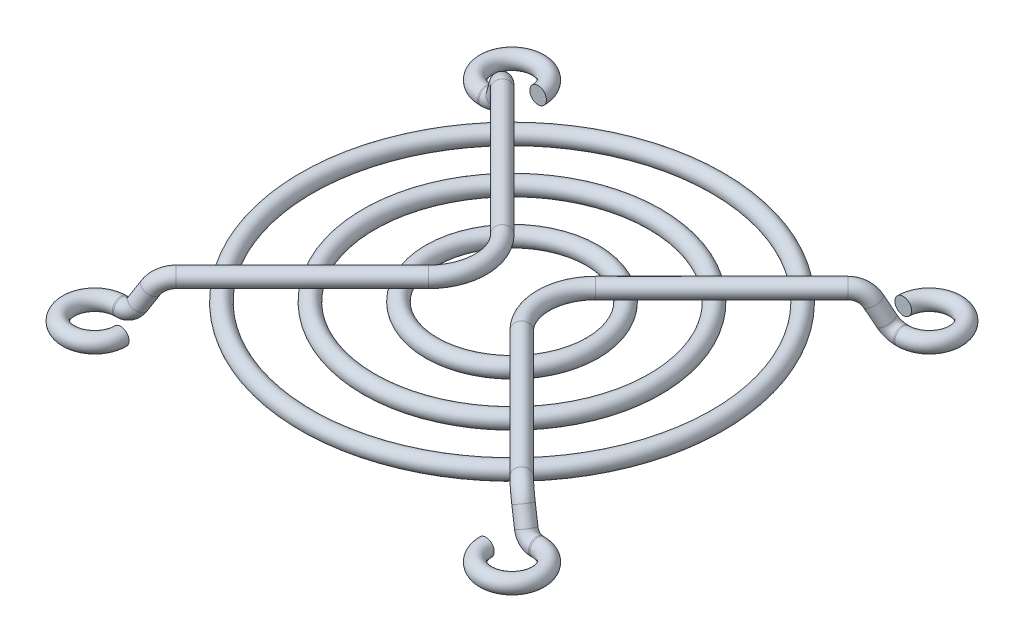
from build123d import *

# Parameters (mm, degrees)
SKETCH_2_R           = 0.8
SWEEP_2_OUTLINE_R    = 0.8
SWEEP_2_ANGLE        = 270
SWEEP_2_2_OUTLINE_R  = 0.8
SWEEP_2_2_ANGLE      = 64.201526
SWEEP_2_3_OUTLINE_R  = 0.8
SWEEP_2_3_ANGLE      = 59.495369
SWEEP_2_4_OUTLINE_R  = 0.8
SWEEP_2_4_ANGLE      = 90
SWEEP_2_5_OUTLINE_R  = 0.8
SWEEP_2_5_ANGLE      = 59.495369
SWEEP_2_6_OUTLINE_R  = 0.8
SWEEP_2_6_ANGLE      = 64.201526
SWEEP_2_7_OUTLINE_R  = 0.8
SWEEP_2_7_ANGLE      = 270
SWEEP_START          = -20.0000001
SWEEP_2_8_OUTLINE_R  = 0.8
SWEEP_2_8_DEPTH      = 0.121755873
SWEEP_START_2        = -13.704918083
SWEEP_2_9_OUTLINE_R  = 0.8
SWEEP_2_9_DEPTH      = 1.722294661
SWEEP_START_3        = -22.766167048
SWEEP_2_10_OUTLINE_R = 0.8
SWEEP_2_10_DEPTH     = 17.109312899
SWEEP_2_11_OUTLINE_R = 0.8
SWEEP_2_11_DEPTH     = 17.109312899
SWEEP_2_12_OUTLINE_R = 0.8
SWEEP_2_12_DEPTH     = 1.722294661
SWEEP_2_13_OUTLINE_R = 0.8
SWEEP_2_13_DEPTH     = 0.121755873


with BuildPart() as part:
    # По траектории1: sweep along a path in Эскиз1
    with BuildLine(Plane(origin=(0, 0, 0), x_dir=(1, 0, 0), z_dir=(0, 1, 0))) as sweep_1_path:
        CenterArc((0, 0), 19.7, 0, 360)
    # Эскиз2 → По траектории1 (sweep)
    with BuildSketch(Plane.XY):
        with Locations((19.7, 0)):
            Circle(SKETCH_2_R)
        with Locations((13.7, 0)):
            Circle(SKETCH_2_R)
        with Locations((7.7, 0)):
            Circle(SKETCH_2_R)
    sweep(path=sweep_1_path.line)


with BuildPart() as body_2:
    # По траектории2: read off the stored shape, not the designer's step
    # По траектории2 outline → По траектории2 (revolve)
    with BuildSketch(Plane(origin=(-20, 0, -20), x_dir=(1, 0, 0), z_dir=(0, 0, 1))):
        with Locations((2.5, -1.6)):
            Circle(SWEEP_2_OUTLINE_R)
    revolve(axis=Axis((-20, 0, -20), (0, 1, 0)), revolution_arc=SWEEP_2_ANGLE)

    # Sweep 2 2 outline → Sweep 2 2 (revolve)
    with BuildSketch(Plane(origin=(-19.878244327, -5.329425132, -1.762276403), x_dir=(0.9003303642061087, -0.41320279112716485, -0.13663340987187678), z_dir=(0.4352071176905264, 0.8548091340984039, 0.28265899768703884))):
        with Locations((1.4, 16.112869261)):
            Circle(SWEEP_2_2_OUTLINE_R)
    revolve(axis=Axis((-19.878244327, -5.329425132, -1.762276403), (0, 0.3139503108242731, -0.9494394147776584)), revolution_arc=SWEEP_2_2_ANGLE)

    # Sweep 2 3 outline → Sweep 2 3 (revolve)
    with BuildSketch(Plane(origin=(-16.141916519, -0.490931402, -16.054305543), x_dir=(-0.5642976565367117, 0.5036141214653419, -0.6541719739394735), z_dir=(-0.4352071176904984, -0.8548091340984196, -0.28265899768703395))):
        with Locations((2, -0.852000479)):
            Circle(SWEEP_2_3_OUTLINE_R)
    revolve(axis=Axis((-16.141916519, -0.490931402, -16.054305543), (0.701543241389085, -0.12519648925829302, -0.701543241389078)), revolution_arc=SWEEP_2_3_ANGLE)

    # Sweep 2 4 outline → Sweep 2 4 (revolve)
    with BuildSketch(Plane(origin=(-8, 0, 0), x_dir=(0.7071067811865462, 0, 0.7071067811865488), z_dir=(-0.7071067811865488, 0, 0.7071067811865462))):
        with Locations((5.000000002, 1.6)):
            Circle(SWEEP_2_4_OUTLINE_R)
    revolve(axis=Axis((-8, 0, 0), (0, 1, 0)), revolution_arc=SWEEP_2_4_ANGLE)

    # Sweep 2 5 outline → Sweep 2 5 (revolve)
    with BuildSketch(Plane(origin=(-16.141916519, -0.490931402, 16.054305543), x_dir=(0.0885272865352453, 0.9921319665636316, 0.08852728653521139), z_dir=(0.7071067811865503, -2.468164561619801e-14, -0.7071067811865446))):
        with Locations((2, -0.852000479)):
            Circle(SWEEP_2_5_OUTLINE_R)
    revolve(axis=Axis((-16.141916519, -0.490931402, 16.054305543), (0.7015432413890837, -0.12519648925820898, 0.701543241389094)), revolution_arc=SWEEP_2_5_ANGLE)

    # Sweep 2 6 outline → Sweep 2 6 (revolve)
    with BuildSketch(Plane(origin=(-19.878244327, -5.329425132, 1.762276403), x_dir=(0, -0.9494394147776485, 0.3139503108243032), z_dir=(-1, 0, 0))):
        with Locations((1.4, 16.112869261)):
            Circle(SWEEP_2_6_OUTLINE_R)
    revolve(axis=Axis((-19.878244327, -5.329425132, 1.762276403), (0, 0.31395031082430325, 0.9494394147776487)), revolution_arc=SWEEP_2_6_ANGLE)

    # Sweep 2 7 outline → Sweep 2 7 (revolve)
    with BuildSketch(Plane(origin=(-20, 0, 20), x_dir=(0, 0, -1), z_dir=(1, 0, 0))):
        with Locations((2.5, -1.6)):
            Circle(SWEEP_2_7_OUTLINE_R)
    revolve(axis=Axis((-20, 0, 20), (0, 1, 0)), revolution_arc=SWEEP_2_7_ANGLE)

    # Sweep 2 8 outline → Sweep 2 8 (add)
    with BuildSketch(Plane.YZ.offset(SWEEP_START)):
        with Locations((-1.6, -17.5)):
            Circle(SWEEP_2_8_OUTLINE_R)
    extrude(amount=SWEEP_2_8_DEPTH)

    # Sweep 2 9 outline → Sweep 2 9 (add)
    with BuildSketch(Plane(origin=(0, 0, 0), x_dir=(0.9003303642061189, -0.41320279112714453, -0.13663340987187061), z_dir=(0.4352071176905052, 0.8548091340984133, 0.2826589976870431)).offset(SWEEP_START_2)):
        with Locations((-14.054067781, 16.112869261)):
            Circle(SWEEP_2_9_OUTLINE_R)
    extrude(amount=SWEEP_2_9_DEPTH)

    # Sweep 2 10 outline → Sweep 2 10 (add)
    with BuildSketch(Plane(origin=(0, 0, 0), x_dir=(0.7071067811865509, 0, -0.707106781186544), z_dir=(0.707106781186544, 0, 0.707106781186551)).offset(SWEEP_START_3)):
        with Locations((-0.656854248, 1.6)):
            Circle(SWEEP_2_10_OUTLINE_R)
    extrude(amount=SWEEP_2_10_DEPTH)

    # Sweep 2 11 outline → Sweep 2 11 (add)
    with BuildSketch(Plane(origin=(0, 0, 0), x_dir=(0.707106781186542, 0, 0.707106781186553), z_dir=(0.707106781186553, 0, -0.707106781186542)).offset(SWEEP_START_3)):
        with Locations((-0.656854248, -1.6)):
            Circle(SWEEP_2_11_OUTLINE_R)
    extrude(amount=SWEEP_2_11_DEPTH)

    # Sweep 2 12 outline → Sweep 2 12 (add)
    with BuildSketch(Plane(origin=(0, 0, 0), x_dir=(0.9003303642061442, -0.41320279112709024, 0.13663340987186817), z_dir=(0.4352071176904529, 0.8548091340984277, -0.28265899768707997)).offset(SWEEP_START_2)):
        with Locations((-14.054067781, -16.112869261)):
            Circle(SWEEP_2_12_OUTLINE_R)
    extrude(amount=SWEEP_2_12_DEPTH)

    # Sweep 2 13 outline → Sweep 2 13 (add)
    with BuildSketch(Plane.YZ.offset(SWEEP_START)):
        with Locations((-1.6, 17.5)):
            Circle(SWEEP_2_13_OUTLINE_R)
    extrude(amount=SWEEP_2_13_DEPTH)


with BuildPart() as body_3:
    # Зеркальное отражение1: mirrored copy
    add(body_2.part.mirror(Plane(origin=(0, 0, 0), x_dir=(0, 0, 1), z_dir=(1, 0, 0))))


solid = Compound([part.part, body_2.part, body_3.part])
